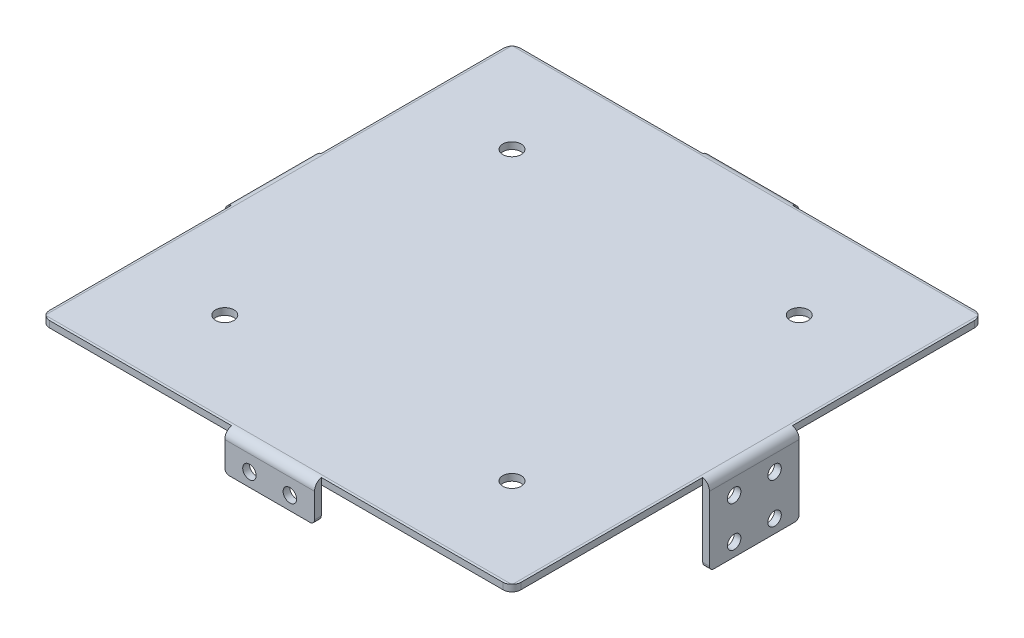
from build123d import *

# Parameters (mm, degrees)
SKETCH1_W                     = 105
SKETCH1_H                     = 105
BOSS_EXTRUDE1_DEPTH           = 1.5
SKETCH2_W                     = 20
SKETCH2_H                     = 1.5
BOSS_EXTRUDE2_DEPTH           = 8.5
SKETCH3_W                     = 1.5
SKETCH3_H                     = 20
BOSS_EXTRUDE3_DEPTH           = 17.45
SKETCH4_R                     = 1.5
CUT_EXTRUDE1_DEPTH            = 122.796561938
SKETCH5_R                     = 1.5
CUT_EXTRUDE2_DEPTH            = 122.796561938
FILLET1_R                     = 1
FILLET2_START                 = -53.84589
FILLET2_DEPTH                 = 107.69178
FILLET2_START_2               = -53
FILLET2_2_DEPTH               = 106
FILLET3_R                     = 2
SKETCH6_R                     = 2.05
HOLES_FOR_BULKHEAD_RODS_DEPTH = 10


with BuildPart() as part:
    # Sketch1 → Boss-Extrude1 (new body)
    with BuildSketch(Plane(origin=(0, 0, 0), x_dir=(1, 0, 0), z_dir=(0, 1, 0))):
        Rectangle(SKETCH1_W, SKETCH1_H)
    extrude(amount=BOSS_EXTRUDE1_DEPTH)

    # Sketch2 → Boss-Extrude2 (add)
    with BuildSketch(Plane(origin=(0, 1.5, 0), x_dir=(1, 0, 0), z_dir=(0, 1, 0))):
        with Locations((0, 53.25)):
            Rectangle(SKETCH2_W, SKETCH2_H)
        with Locations((0, -53.25)):
            Rectangle(SKETCH2_W, SKETCH2_H)
    extrude(amount=-BOSS_EXTRUDE2_DEPTH)

    # Sketch3 → Boss-Extrude3 (add)
    with BuildSketch(Plane(origin=(0, 1.5, 0), x_dir=(1, 0, 0), z_dir=(0, 1, 0))):
        with Locations((53.25, 0)):
            Rectangle(SKETCH3_W, SKETCH3_H)
        with Locations((-53.25, 0)):
            Rectangle(SKETCH3_W, SKETCH3_H)
    extrude(amount=-BOSS_EXTRUDE3_DEPTH)

    # Sketch4 → Cut-Extrude1 (cut, through all)
    with BuildSketch(Plane.XY.offset(54)):
        with Locations((-4.5, -4)):
            Circle(SKETCH4_R)
        with Locations(Location((4.5, -4, 0), (0, 0, 180))):
            Circle(SKETCH4_R)
    extrude(amount=-CUT_EXTRUDE1_DEPTH, mode=Mode.SUBTRACT)

    # Sketch5 → Cut-Extrude2 (cut, through all)
    with BuildSketch(Plane(origin=(54, 0, 0), x_dir=(0, 0, -1), z_dir=(1, 0, 0))):
        with Locations((-4.5, -4)):
            Circle(SKETCH5_R)
        with Locations((4.5, -4)):
            Circle(SKETCH5_R)
        with Locations((4.5, -13)):
            Circle(SKETCH5_R)
        with Locations((-4.5, -13)):
            Circle(SKETCH5_R)
    extrude(amount=-CUT_EXTRUDE2_DEPTH, mode=Mode.SUBTRACT)

    # Fillet1
    fillet1_edges = [part.edges().sort_by_distance(p)[0] for p in [
        (-10, -7, -53.25),
        (10, -7, -53.25),
        (-10, -7, 53.25),
        (10, -7, 53.25),
        (53.25, -15.95, -10),
        (53.25, -15.95, 10),
        (-53.25, -15.95, 10),
        (-53.25, -15.95, -10),
    ]]
    fillet(fillet1_edges, radius=FILLET1_R)

    # Fillet2: read off the stored shape, not the designer's step
    # Fillet2 outline → Fillet2 (cut)
    with BuildSketch(Plane.XY.offset(FILLET2_START)):
        with BuildLine():
            ThreePointArc((52, 1.5), (53.414213562, 0.914213562), (54, -0.5))
            Line((54, -0.5), (54, 1.5))
            Line((54, 1.5), (52, 1.5))
        make_face()
        with BuildLine():
            Line((-52, 1.5), (-54, 1.5))
            Line((-54, 1.5), (-54, -0.5))
            ThreePointArc((-54, -0.5), (-53.414213562, 0.914213562), (-52, 1.5))
        make_face()
    extrude(amount=FILLET2_DEPTH, mode=Mode.SUBTRACT)

    # Fillet2 2 outline → Fillet2 2 (cut)
    with BuildSketch(Plane.YZ.offset(FILLET2_START_2)):
        with BuildLine():
            ThreePointArc((1.5, -52), (0.914213562, -53.414213562), (-0.5, -54))
            Line((-0.5, -54), (1.5, -54))
            Line((1.5, -54), (1.5, -52))
        make_face()
        with BuildLine():
            Line((1.5, 52), (1.5, 54))
            Line((1.5, 54), (-0.5, 54))
            ThreePointArc((-0.5, 54), (0.914213562, 53.414213562), (1.5, 52))
        make_face()
    extrude(amount=FILLET2_2_DEPTH, mode=Mode.SUBTRACT)

    # Fillet3
    # the kernel refuses this fillet: 2 mm, written as the material it takes off along each edge
    with BuildSketch(Plane(origin=(52.5, -5, -52.5), x_dir=(0, 0, 1), z_dir=(0, 1, 0)), Plane(origin=(52.5, -5, 52.5), x_dir=(-1, 0, 0), z_dir=(0, 1, 0)), Plane(origin=(-52.5, -5, -52.5), x_dir=(1, 0, 0), z_dir=(0, 1, 0))) as fillet3_piece_1:
        with BuildLine():
            CenterArc((FILLET3_R, -FILLET3_R), FILLET3_R, 90, 90)
            Line((0, -FILLET3_R), (0, 0))
            Line((0, 0), (FILLET3_R, 0))
        make_face()
    extrude(amount=11.436491673, mode=Mode.SUBTRACT)
    with BuildSketch(Plane(origin=(-52.5, -5, 52.5), x_dir=(1, 0, 0), z_dir=(0, 1, 0))) as fillet3_piece_2:
        with BuildLine():
            CenterArc((FILLET3_R, FILLET3_R), FILLET3_R, 180, 90)
            Line((0, FILLET3_R), (0, 0))
            Line((0, 0), (FILLET3_R, 0))
        make_face()
    extrude(amount=11.436491673, mode=Mode.SUBTRACT)

    # Sketch6 → Holes for Bulkhead Rods (cut)
    with BuildSketch(Plane(origin=(0, 1.5, 0), x_dir=(1, 0, 0), z_dir=(0, 1, 0))):
        with Locations(Location((-32, 32, 0), (0, 0, 270))):
            Circle(SKETCH6_R)
        with Locations(Location((32, 32, 0), (0, 0, 270))):
            Circle(SKETCH6_R)
        with Locations(Location((-32, -32, 0), (0, 0, 270))):
            Circle(SKETCH6_R)
        with Locations(Location((32, -32, 0), (0, 0, 270))):
            Circle(SKETCH6_R)
    extrude(amount=-HOLES_FOR_BULKHEAD_RODS_DEPTH, mode=Mode.SUBTRACT)


solid = part.part
